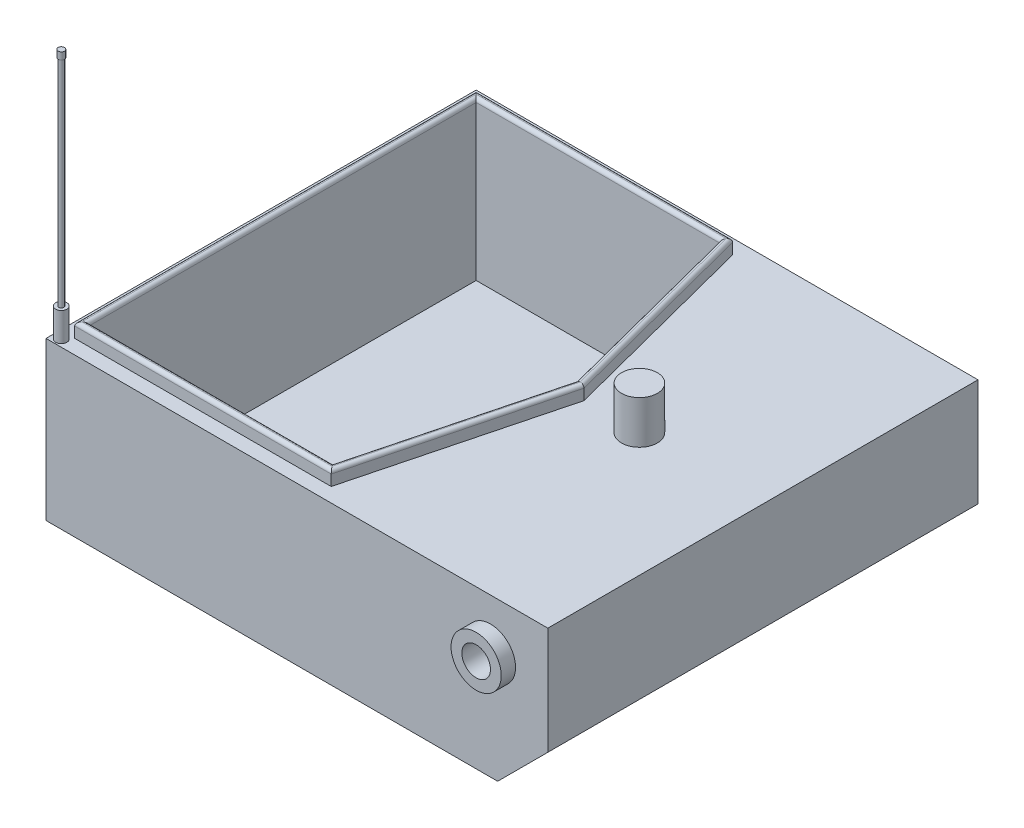
from build123d import *

# Parameters (mm, degrees)
BOSS_EXTRUDE1_DEPTH = 600
CUT_EXTRUDE1_DEPTH  = 200
BOSS_EXTRUDE2_DEPTH = 20
FILLET1_R           = 5
SKETCH4_R           = 35
BOSS_EXTRUDE3_DEPTH = 20
BOSS_EXTRUDE4_START = 20
SKETCH5_R           = 35
BOSS_EXTRUDE4_DEPTH = 20
SKETCH6_R           = 10
CUT_EXTRUDE2_DEPTH  = 741.945342114
SKETCH7_R           = 25
BOSS_EXTRUDE5_DEPTH = 60
SKETCH9_R           = 20
CUT_EXTRUDE3_DEPTH  = 749.999332443
SKETCH10_R          = 7.841324839
BOSS_EXTRUDE6_DEPTH = 40
SKETCH11_R          = 3.5
BOSS_EXTRUDE7_DEPTH = 300
SKETCH12_R          = 4.427649499
BOSS_EXTRUDE8_DEPTH = 10


with BuildPart() as part:
    # Sketch1 → Boss-Extrude1 (new body)
    with BuildSketch(Plane.XY):
        Polygon((280, -110), (350, -40), (350, 110), (-350, 110), (-350, -110), align=None)
    extrude(amount=BOSS_EXTRUDE1_DEPTH)

    # Sketch2 → Cut-Extrude1 (cut)
    with BuildSketch(Plane(origin=(0, 110, 0), x_dir=(1, 0, 0), z_dir=(0, 1, 0))):
        Polygon((20.098635598, -30), (90.098635598, -300), (20.098635598, -570), (-320, -570), (-320, -30), align=None)
    extrude(amount=-CUT_EXTRUDE1_DEPTH, mode=Mode.SUBTRACT)

    # Sketch3 → Boss-Extrude2 (add)
    with BuildSketch(Plane(origin=(0, 110, 0), x_dir=(1, 0, 0), z_dir=(0, 1, 0))):
        Polygon((-330, -20), (-330, -580), (27.836654621, -580), (100.429247214, -300), (27.836654621, -20), align=None)
        Polygon((-320, -30), (-320, -570), (20.098635598, -570), (90.098635598, -300), (20.098635598, -30), align=None, mode=Mode.SUBTRACT)
    extrude(amount=BOSS_EXTRUDE2_DEPTH)

    # Fillet1
    fillet1_edges = [part.edges().sort_by_distance(p)[0] for p in [
        (-151.081672689, 130, 20),
        (-330, 130, 300),
        (-151.081672689, 130, 580),
        (64.132950917, 130, 440),
        (64.132950917, 130, 160),
        (-149.950682201, 130, 30),
        (-320, 130, 300),
        (-149.950682201, 130, 570),
        (55.098635598, 130, 435),
        (55.098635598, 130, 165),
    ]]
    fillet(fillet1_edges, radius=FILLET1_R - 0.0001)  # a hair under: the kernel refuses the full size

    # Sketch4 → Boss-Extrude3 (add)
    with BuildSketch(Plane.XY.offset(600)):
        with Locations(Location((270, 40, 0), (0, 0, 180))):
            Circle(SKETCH4_R)
    extrude(amount=BOSS_EXTRUDE3_DEPTH)

    # Sketch5 → Boss-Extrude4 (add)
    with BuildSketch(Plane(origin=(0, 0, 0), x_dir=(-1, 0, 0), z_dir=(0, 0, -1)).offset(BOSS_EXTRUDE4_START)):
        with Locations((-270, 40)):
            Circle(SKETCH5_R)
    extrude(amount=-BOSS_EXTRUDE4_DEPTH)

    # Sketch6 → Cut-Extrude2 (cut, through all)
    with BuildSketch(Plane.XY.offset(620)):
        with Locations((270, 40)):
            Circle(SKETCH6_R)
    extrude(amount=-CUT_EXTRUDE2_DEPTH, mode=Mode.SUBTRACT)

    # Sketch7 → Boss-Extrude5 (add)
    with BuildSketch(Plane(origin=(0, 110, 0), x_dir=(1, 0, 0), z_dir=(0, 1, 0))):
        with Locations(Location((177.752116484, -300, 0), (0, 0, 90))):
            Circle(SKETCH7_R)
    extrude(amount=BOSS_EXTRUDE5_DEPTH)

    # Sketch9 → Cut-Extrude3 (cut, through all)
    with BuildSketch(Plane.XY.offset(620)):
        with Locations((270, 40)):
            Circle(SKETCH9_R)
    extrude(amount=-CUT_EXTRUDE3_DEPTH, mode=Mode.SUBTRACT)

    # Sketch10 → Boss-Extrude6 (add)
    with BuildSketch(Plane(origin=(0, 110, 0), x_dir=(1, 0, 0), z_dir=(0, 1, 0))):
        with Locations(Location((-338.53526131, -590.113534013, 0), (0, 0, 90))):
            Circle(SKETCH10_R)
    extrude(amount=BOSS_EXTRUDE6_DEPTH)

    # Sketch11 → Boss-Extrude7 (add)
    with BuildSketch(Plane(origin=(0, 150, 0), x_dir=(1, 0, 0), z_dir=(0, 1, 0))):
        with Locations(Location((-338.53526131, -590.113534013, 0), (0, 0, 270))):
            Circle(SKETCH11_R)
    extrude(amount=BOSS_EXTRUDE7_DEPTH)

    # Sketch12 → Boss-Extrude8 (add)
    with BuildSketch(Plane(origin=(0, 450, 0), x_dir=(1, 0, 0), z_dir=(0, 1, 0))):
        with Locations(Location((-338.53526131, -590.113534013, 0), (0, 0, 270))):
            Circle(SKETCH12_R)
    extrude(amount=BOSS_EXTRUDE8_DEPTH)


solid = part.part
